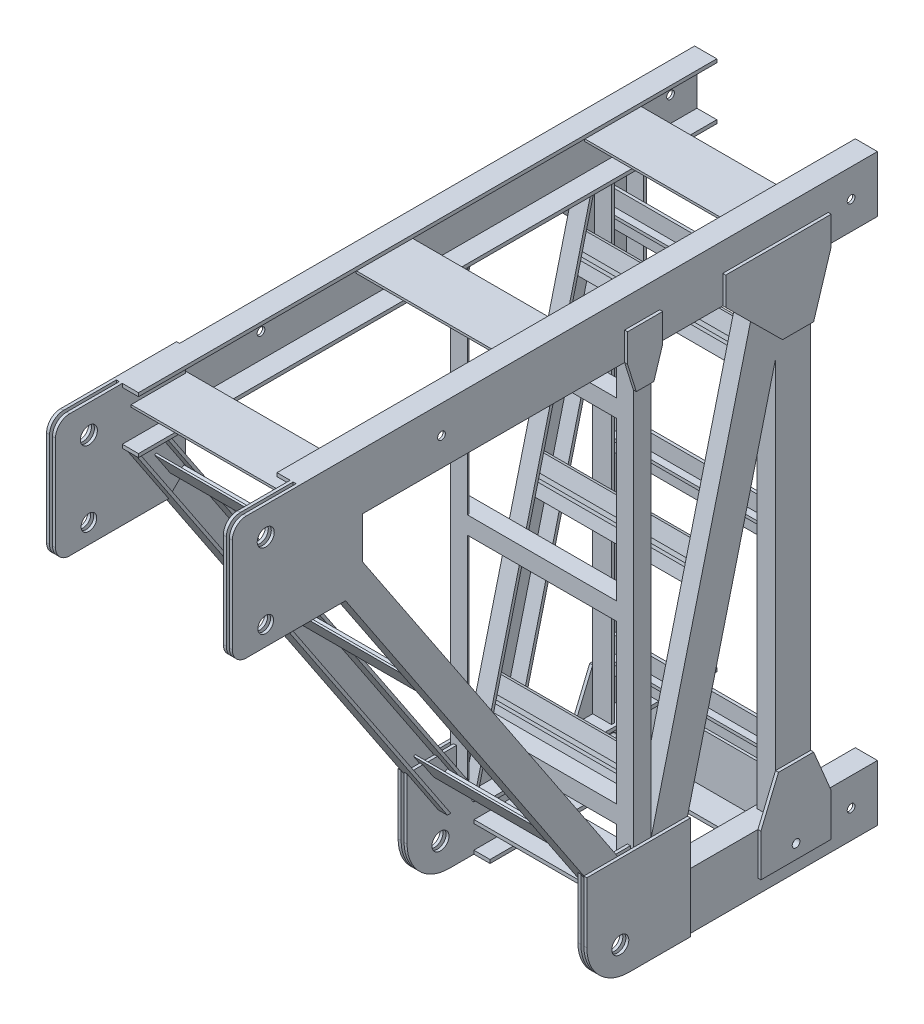
from build123d import *

# Parameters (mm, degrees)
EXTRUDE_1_DEPTH                   = 1835
EXTRUDE_1_2_DEPTH                 = 1835
PATTERN_LINEAR_2_COUNT            = 2
PATTERN_LINEAR_2_PITCH            = 1500
SKETCH_4_W                        = 520
SKETCH_4_H                        = 1000
CUT_EXTRUDE_2_DEPTH               = 1000
EXTRUDE_3_DEPTH                   = 520
SKETCH_8_W                        = 100
SKETCH_8_H                        = 1340
EXTRUDE_7_DEPTH                   = 520
CUT_EXTRUDE_9_DEPTH               = 1340
SKETCH_11_R                       = 11
CUT_EXTRUDE_10_DEPTH              = 2427.442869717
EXTRUDE_11_DEPTH                  = 48
PATTERN_LINEAR_3_COUNT            = 2
PATTERN_LINEAR_3_PITCH            = 472
CUT_EXTRUDE_12_DEPTH              = 42.7
CUT_EXTRUDE_13_DEPTH              = 42.7
EXTRUDE_14_DEPTH                  = 43
PATTERN_LINEAR_4_COUNT            = 2
PATTERN_LINEAR_4_PITCH            = 477
CUT_EXTRUDE_15_DEPTH              = 38
CUT_EXTRUDE_16_DEPTH              = 38
EXTRUDE_17_DEPTH                  = 520
SKETCH_19_W                       = 394
SKETCH_19_H                       = 50
CUT_EXTRUDE_18_DEPTH              = 2427.442869717
CUT_EXTRUDE_19_DEPTH              = 15
CUT_EXTRUDE_20_DEPTH              = 15
CUT_EXTRUDE_21_DEPTH              = 45
CUT_EXTRUDE_22_DEPTH              = 45
PATTERN_LINEAR_6_COUNT            = 3
PATTERN_LINEAR_6_PITCH            = 650
SKETCH_27_W                       = 520
SKETCH_27_H                       = 160
EXTRUDE_24_DEPTH                  = 10
SKETCH_28_W                       = 507
SKETCH_28_H                       = 10
EXTRUDE_25_DEPTH                  = 140
EXTRUDE_26_DEPTH                  = 520
PATTERN_LINEAR_9_COUNT            = 3
PATTERN_LINEAR_9_PITCH            = 550
EXTRUDE_27_DEPTH                  = 520
PATTERN_LINEAR_10_COUNT           = 3
PATTERN_LINEAR_10_PITCH           = 500
EXTRUDE_28_DEPTH                  = 520
SKETCH_32_W                       = 394
SKETCH_32_H                       = 5
EXTRUDE_29_DEPTH                  = 15
PATTERN_LINEAR_11_COUNT           = 3
PATTERN_LINEAR_11_PITCH           = 675
SKETCH_38_W                       = 520
SKETCH_38_H                       = 50
EXTRUDE_36_DEPTH                  = 50
SKETCH_38_2_W                     = 520
SKETCH_38_2_H                     = 50
EXTRUDE_37_DEPTH                  = 50
PATTERN_LINEAR_13_COUNT           = 3
PATTERN_LINEAR_13_PITCH           = 500
SKETCH_39_W                       = 514
SKETCH_39_H                       = 45
CUT_EXTRUDE_38_DEPTH              = 45
SKETCH_40_W                       = 294.761063943
SKETCH_40_H                       = 292.888974491
EXTRUDE_39_DEPTH                  = 8.5
PATTERN_LINEAR_15_COUNT           = 2
PATTERN_LINEAR_15_PITCH           = 17
PATTERN_LINEAR_16_COUNT           = 2
PATTERN_LINEAR_16_PITCH           = 511.5
PATTERN_LINEAR_16_COPY_1_SKETCH_W = 294.761063943
PATTERN_LINEAR_16_COPY_1_SKETCH_H = 292.888974491
PATTERN_LINEAR_16_COPY_1_DEPTH    = 8.5
SKETCH_41_W                       = 8.5
SKETCH_41_H                       = 160
SKETCH_41_W_2                     = 486
CUT_EXTRUDE_40_DEPTH              = 190
SKETCH_42_W                       = 160
SKETCH_42_H                       = 10
EXTRUDE_41_DEPTH                  = 503
FILLET_1_R                        = 120
SKETCH_43_R                       = 24.25
CUT_EXTRUDE_42_DEPTH              = 2431.142794158
SKETCH_44_W                       = 370
SKETCH_44_H                       = 350
EXTRUDE_43_DEPTH                  = 8.5
PATTERN_LINEAR_17_COUNT           = 2
PATTERN_LINEAR_17_PITCH           = 17
SKETCH_45_W                       = 8.5
SKETCH_45_H                       = 350
SKETCH_45_W_2                     = 496.5
CUT_EXTRUDE_44_DEPTH              = 190
CHAMFER_1_SIZE                    = 50
SKETCH_46_R                       = 24.25
CUT_EXTRUDE_45_DEPTH              = 2431.142794158
EXTRUDE_46_DEPTH                  = 8.5
PATTERN_LINEAR_19_COUNT           = 2
PATTERN_LINEAR_19_PITCH           = 528.5
PATTERN_LINEAR_20_COUNT           = 2
PATTERN_LINEAR_20_PITCH           = 520
PATTERN_LINEAR_21_COUNT           = 2
PATTERN_LINEAR_21_PITCH           = 503
SKETCH_49_R                       = 24.25
SKETCH_49_R_2                     = 22.25
CUT_EXTRUDE_48_DEPTH              = 2429.278659874
FILLET_2_R                        = 40
SKETCH_50_R                       = 11
CUT_EXTRUDE_49_DEPTH              = 2431.142794158


with BuildPart() as part:
    # 草图2 → 拉伸1 (new body)
    with BuildSketch(Plane.XY):
        Polygon((0, 0), (0, 160), (63, 160), (63, 150), (6.5, 150), (6.5, 10), (63, 10), (63, 0), align=None)
    extrude_1 = extrude(amount=EXTRUDE_1_DEPTH)



with BuildPart() as body_2:
    # 草图2 → Extrude 1 2 (new body)
    with BuildSketch(Plane.XY):
        Polygon((457, 160), (520, 160), (520, 0), (457, 0), (457, 10), (513.5, 10), (513.5, 150), (457, 150), align=None)
    extrude_1_2 = extrude(amount=EXTRUDE_1_2_DEPTH)


with BuildPart() as pattern_linear_2_1:
    # 阵列(线性)2: pattern copy
    add(extrude_1.moved(Location(Vector(0, -1, 0) * (1 * PATTERN_LINEAR_2_PITCH))))


with BuildPart() as pattern_linear_2_2:
    # 阵列(线性)2: pattern copy
    add(extrude_1_2.moved(Location(Vector(0, -1, 0) * (1 * PATTERN_LINEAR_2_PITCH))))


with BuildPart() as cut_extrude_2_tool:
    # 草图4 → 拉伸2 (new body)
    with BuildSketch(Plane(origin=(0, -1340, 0), x_dir=(1, 0, 0), z_dir=(0, 1, 0))):
        with Locations((260, -1335)):
            Rectangle(SKETCH_4_W, SKETCH_4_H)
    extrude(amount=-CUT_EXTRUDE_2_DEPTH)


with BuildPart() as pattern_linear_2_1_1:
    add(pattern_linear_2_1.part)

    # 拉伸2: cut by cut_extrude_2_tool
    add(cut_extrude_2_tool.part, mode=Mode.SUBTRACT)


with BuildPart() as pattern_linear_2_2_1:
    add(pattern_linear_2_2.part)

    # 拉伸2: cut by cut_extrude_2_tool
    add(cut_extrude_2_tool.part, mode=Mode.SUBTRACT)


with BuildPart() as part_1:
    add(part.part)

    add(body_2.part)  # 拉伸3 merges body 2
    # 草图5 → 拉伸3 (add)
    with BuildSketch(Plane.ZY):
        Polygon((160, 95), (320, 95), (320, 88.5), (243.25, 88.5), (243.25, 48.5), (236.75, 48.5), (236.75, 88.5), (160, 88.5), align=None)
    extrude_3 = extrude(amount=-EXTRUDE_3_DEPTH)

    # 草图11 → 拉伸10 (cut, through all)
    with BuildSketch(Plane.ZY):
        with Locations((1740, 80)):
            Circle(SKETCH_11_R)
    extrude(amount=-CUT_EXTRUDE_10_DEPTH, mode=Mode.SUBTRACT)


    add(pattern_linear_2_1_1.part)  # 拉伸11 merges 阵列(线性)2_1


with BuildPart() as body_4:
    # 草图8 → 拉伸7 (new body)
    with BuildSketch(Plane.ZY):
        with Locations((240, -670)):
            Rectangle(SKETCH_8_W, SKETCH_8_H)
    extrude(amount=-EXTRUDE_7_DEPTH)

    # 草图10 → 拉伸9 (cut)
    with BuildSketch(Plane.XZ.offset(1340)):
        Polygon((466.7, 290), (466.7, 281.5), (514.7, 281.5), (514.7, 198.5), (466.7, 198.5), (466.7, 190), (53.3, 190), (53.3, 198.5), (5.3, 198.5), (5.3, 281.5), (53.3, 281.5), (53.3, 290), align=None)
    extrude(amount=-CUT_EXTRUDE_9_DEPTH, mode=Mode.SUBTRACT)


with BuildPart() as cut_extrude_9_piece_1:
    # of the separate pieces the step leaves, piece 1, a body of its own (cut_extrude_9_pieces)
    add(body_4.part.solids().sort_by_distance((0, 0, 190))[0])


with BuildPart() as cut_extrude_9_piece_2:
    # of the separate pieces the step leaves, piece 2, a body of its own (cut_extrude_9_pieces)
    add(body_4.part.solids().sort_by_distance((466.7, 0, 198.5))[0])


with BuildPart() as part_2:
    add(part_1.part)

    add(cut_extrude_9_piece_1.part)  # 拉伸11 merges 拉伸9 piece 1
    # 草图12 → 拉伸11 (add)
    with BuildSketch(Plane.ZY):
        Polygon((290, 0), (341.53882032, 0), (676.53882032, -1340), (573.46117968, -1340), (290, -206.155281281), align=None)
    extrude_11 = extrude(amount=-EXTRUDE_11_DEPTH)


    add(pattern_linear_2_2_1.part)  # 阵列(线性)3 merges 阵列(线性)2_2

    add(cut_extrude_9_piece_2.part)  # 阵列(线性)3 merges 拉伸9 piece 2
    # 阵列(线性)3: 拉伸11 ×2
    with Locations(*[(i * PATTERN_LINEAR_3_PITCH, 0, 0) for i in range(1, PATTERN_LINEAR_3_COUNT)]):
        add(extrude_11)

    # 草图13 → 拉伸12 (cut)
    with BuildSketch(Plane(origin=(48, 0, 0), x_dir=(0, 0, -1), z_dir=(1, 0, 0))):
        Polygon((-332.777220866, 0), (-290, 0), (-290, -171.108883463), (-582.222779134, -1340), (-667.777220866, -1340), align=None)
    extrude(amount=-CUT_EXTRUDE_12_DEPTH, mode=Mode.SUBTRACT)

    # 草图14 → 拉伸13 (cut)
    with BuildSketch(Plane.ZY.offset(-472)):
        Polygon((290, -241.201679099), (290, 0), (332.777220866, 0), (667.777220866, -1340), (564.699580225, -1340), align=None)
    extrude(amount=-CUT_EXTRUDE_13_DEPTH, mode=Mode.SUBTRACT)

    # 草图15 → 拉伸14 (add)
    with BuildSketch(Plane.ZY):
        Polygon((1591.666666667, 0), (1543.59264966, 0), (669.371682868, -1311.331450189), (676.53882032, -1340), (746.40735034, -1340), (1639.740683673, 0), align=None)
    extrude_14 = extrude(amount=-EXTRUDE_14_DEPTH)

    # 阵列(线性)4: 拉伸14 ×2
    with Locations(*[(i * PATTERN_LINEAR_4_PITCH, 0, 0) for i in range(1, PATTERN_LINEAR_4_COUNT)]):
        add(extrude_14)

    # 草图16 → 拉伸15 (cut)
    with BuildSketch(Plane.ZY.offset(-477)):
        Polygon((1553.207453062, 0), (1630.125880272, 0), (736.792546938, -1340), (659.874119728, -1340), align=None)
    extrude(amount=-CUT_EXTRUDE_15_DEPTH, mode=Mode.SUBTRACT)

    # 草图17 → 拉伸16 (cut)
    with BuildSketch(Plane(origin=(43, 0, 0), x_dir=(0, 0, -1), z_dir=(1, 0, 0))):
        Polygon((-1630.125880272, 0), (-1553.207453062, 0), (-659.874119728, -1340), (-736.792546938, -1340), align=None)
    extrude(amount=-CUT_EXTRUDE_16_DEPTH, mode=Mode.SUBTRACT)

    # 阵列(线性)6: 拉伸3 ×3
    with Locations(*[(0, 0, i * PATTERN_LINEAR_6_PITCH) for i in range(1, PATTERN_LINEAR_6_COUNT)]):
        add(extrude_3)

    # 草图27 → 拉伸24 (add)
    with BuildSketch(Plane.XZ.offset(1500)):
        with Locations((260, 160)):
            Rectangle(SKETCH_27_W, SKETCH_27_H)
    extrude(amount=-EXTRUDE_24_DEPTH)

    # 草图28 → 拉伸25 (add)
    with BuildSketch(Plane(origin=(0, -1490, 0), x_dir=(1, 0, 0), z_dir=(0, 1, 0))):
        with Locations((260, -157.5)):
            Rectangle(SKETCH_28_W, SKETCH_28_H)
    extrude(amount=EXTRUDE_25_DEPTH)

    # 草图29 → 拉伸26 (add)
    with BuildSketch(Plane.ZY):
        Polygon((231.5, -1165), (231.5, -1265), (240, -1265), (240, -1219.25), (260, -1219.25), (260, -1210.75), (240, -1210.75), (240, -1165), align=None)
    extrude_26 = extrude(amount=-EXTRUDE_26_DEPTH)

    # 阵列(线性)9: 拉伸26 ×3
    with Locations(*[(0, i * PATTERN_LINEAR_9_PITCH, 0) for i in range(1, PATTERN_LINEAR_9_COUNT)]):
        add(extrude_26)

    # 草图30 → 拉伸27 (add)
    with BuildSketch(Plane.ZY):
        Polygon((313.889759066, -130.605434082), (338.14332157, -227.619684097), (346.389532821, -225.558131284), (335.293527976, -181.174111902), (354.696377978, -176.323399401), (352.634825166, -168.07718815), (333.231975163, -172.927900651), (322.135970317, -128.543881269), align=None)
    extrude_27 = extrude(amount=-EXTRUDE_27_DEPTH)

    # 阵列(线性)10: 拉伸27 ×3
    with Locations(*[Vector(0, -0.9701425001453319, 0.24253562503633289) * (i * PATTERN_LINEAR_10_PITCH) for i in range(1, PATTERN_LINEAR_10_COUNT)]):
        add(extrude_27)

    # 草图31 → 拉伸28 (add)
    with BuildSketch(Plane(origin=(520, 0, 0), x_dir=(0, 0, -1), z_dir=(1, 0, 0))):
        Polygon((-1548.908526541, -59.630271094), (-1504.532510843, -126.194294641), (-1508.692762315, -128.967795622), (-1553.068778013, -62.403772075), align=None)
    extrude_28 = extrude(amount=-EXTRUDE_28_DEPTH)

    # 草图32 → 拉伸29 (add)
    with BuildSketch(Plane(origin=(0, -733.228634125, 1099.842951187), x_dir=(-1, 0, 0), z_dir=(0, 0.5547001962252273, -0.8320502943378449))):
        with Locations((-260, 769.564478992)):
            Rectangle(SKETCH_32_W, SKETCH_32_H)
    extrude_29 = extrude(amount=EXTRUDE_29_DEPTH)

    # 阵列(线性)11: 拉伸28, 拉伸29 ×3
    with Locations(*[Vector(0, -0.8320502943378444, -0.5547001962252281) * (i * PATTERN_LINEAR_11_PITCH) for i in range(1, PATTERN_LINEAR_11_COUNT)]):
        add(extrude_28)
        add(extrude_29)


with BuildPart() as body_2_2:
    # 草图18 → 拉伸17 (new body)
    with BuildSketch(Plane.ZY):
        Polygon((644.371682868, 0), (694.371682868, 0), (694.371682868, -1273.831450189), (669.371682868, -1311.331450189), (644.371682868, -1211.331450189), align=None)
    extrude(amount=-EXTRUDE_17_DEPTH)

    # 草图19 → 拉伸18 (cut, through all)
    with BuildSketch(Plane(origin=(0, 0, 0), x_dir=(1, 0, 0), z_dir=(0, 1, 0))):
        with Locations((260, -669.371682868)):
            Rectangle(SKETCH_19_W, SKETCH_19_H)
    extrude(amount=-CUT_EXTRUDE_18_DEPTH, mode=Mode.SUBTRACT)


with BuildPart() as cut_extrude_18_piece_1:
    # of the separate pieces the step leaves, piece 1, a body of its own (cut_extrude_18_pieces)
    add(body_2_2.part.solids().sort_by_distance((0, 0, 644.371682868))[0])

    # 草图21 → 拉伸20 (cut)
    with BuildSketch(Plane(origin=(63, 0, 0), x_dir=(0, 0, -1), z_dir=(1, 0, 0))):
        Polygon((-694.371682868, -1273.831450189), (-669.371682868, -1311.331450189), (-644.371682868, -1211.331450189), (-644.371682868, 0), (-694.371682868, 0), align=None)
    extrude(amount=-CUT_EXTRUDE_20_DEPTH, mode=Mode.SUBTRACT)

    # 草图24 → 拉伸22 (cut)
    with BuildSketch(Plane(origin=(48, 0, 0), x_dir=(0, 0, -1), z_dir=(1, 0, 0))):
        Polygon((-689.371682868, -1281.331450189), (-669.371682868, -1311.331450189), (-644.371682868, -1211.331450189), (-644.371682868, 0), (-689.371682868, 0), align=None)
    extrude(amount=-CUT_EXTRUDE_22_DEPTH, mode=Mode.SUBTRACT)


with BuildPart() as cut_extrude_18_piece_2:
    # of the separate pieces the step leaves, piece 2, a body of its own (cut_extrude_18_pieces)
    add(body_2_2.part.solids().sort_by_distance((457, 0, 694.371682868))[0])

    # 草图20 → 拉伸19 (cut)
    with BuildSketch(Plane.ZY.offset(-457)):
        Polygon((644.371682868, 0), (694.371682868, 0), (694.371682868, -1273.831450189), (669.371682868, -1311.331450189), (644.371682868, -1211.331450189), align=None)
    extrude(amount=-CUT_EXTRUDE_19_DEPTH, mode=Mode.SUBTRACT)

    # 草图23 → 拉伸21 (cut)
    with BuildSketch(Plane.ZY.offset(-472)):
        Polygon((689.371682868, -1281.331450189), (669.371682868, -1311.331450189), (644.371682868, -1211.331450189), (644.371682868, 0), (689.371682868, 0), align=None)
    extrude(amount=-CUT_EXTRUDE_21_DEPTH, mode=Mode.SUBTRACT)


    add(cut_extrude_18_piece_1.part)  # 拉伸36 merges 拉伸18 piece 1

    add(part_2.part)  # 拉伸36 merges part
    # 草图38 → 拉伸36 (add)
    with BuildSketch(Plane.XY.offset(694.371682868)):
        with Locations((260, -1148.831450189)):
            Rectangle(SKETCH_38_W, SKETCH_38_H)
    extrude(amount=-EXTRUDE_36_DEPTH)

    # 草图38<2> → 拉伸37 (add)
    with BuildSketch(Plane.XY.offset(694.371682868)):
        with Locations((260, -1148.831450189)):
            Rectangle(SKETCH_38_2_W, SKETCH_38_2_H)
    extrude_37 = extrude(amount=-EXTRUDE_37_DEPTH)

    # 阵列(线性)13: 拉伸37 ×3
    with Locations(*[(0, i * PATTERN_LINEAR_13_PITCH, 0) for i in range(1, PATTERN_LINEAR_13_COUNT)]):
        add(extrude_37)

    # 草图39 → 拉伸38 (cut)
    with BuildSketch(Plane(origin=(0, 0, 644.371682868), x_dir=(-1, 0, 0), z_dir=(0, 0, -1))):
        with Locations((-260, -1151.331450189)):
            Rectangle(SKETCH_39_W, SKETCH_39_H)
        with Locations((-260, -651.331450189)):
            Rectangle(SKETCH_39_W, SKETCH_39_H)
        with Locations((-260, -151.331450189)):
            Rectangle(SKETCH_39_W, SKETCH_39_H)
    extrude(amount=-CUT_EXTRUDE_38_DEPTH, mode=Mode.SUBTRACT)

    # 草图40 → 拉伸39 (add)
    with BuildSketch(Plane(origin=(520, 0, 0), x_dir=(0, 0, -1), z_dir=(1, 0, 0))):
        with Locations((-687.619468029, -1353.555512754)):
            Rectangle(SKETCH_40_W, SKETCH_40_H)
    extrude_39 = extrude(amount=EXTRUDE_39_DEPTH)

    # 阵列(线性)15: 拉伸39 ×2
    with Locations(*[(-i * PATTERN_LINEAR_15_PITCH, 0, 0) for i in range(1, PATTERN_LINEAR_15_COUNT)]):
        add(extrude_39)

    # 阵列(线性)16: 拉伸39 ×2
    with Locations(*[(-i * PATTERN_LINEAR_16_PITCH, 0, 0) for i in range(1, PATTERN_LINEAR_16_COUNT)]):
        add(extrude_39)

    # 阵列(线性)16 copy 1 sketch → 阵列(线性)16 copy 1 (add)
    with BuildSketch(Plane(origin=(-8.5, 0, 0), x_dir=(0, 0, -1), z_dir=(1, 0, 0))):
        with Locations((-687.619468029, -1353.555512754)):
            Rectangle(PATTERN_LINEAR_16_COPY_1_SKETCH_W, PATTERN_LINEAR_16_COPY_1_SKETCH_H)
    extrude(amount=PATTERN_LINEAR_16_COPY_1_DEPTH)

    # 草图41 → 拉伸40 (cut)
    with BuildSketch(Plane.XY.offset(835)):
        with Locations((4.25, -1420)):
            Rectangle(SKETCH_41_W, SKETCH_41_H)
        with Locations((260, -1420)):
            Rectangle(SKETCH_41_W_2, SKETCH_41_H)
        with Locations((515.75, -1420)):
            Rectangle(SKETCH_41_W, SKETCH_41_H)
    extrude(amount=-CUT_EXTRUDE_40_DEPTH, mode=Mode.SUBTRACT)

    # 草图42 → 拉伸41 (add)
    with BuildSketch(Plane.ZY.offset(-503)):
        with Locations((564.371682868, -1420)):
            Rectangle(SKETCH_42_W, SKETCH_42_H)
    extrude(amount=EXTRUDE_41_DEPTH)

    # 圆角1
    fillet_1_edges = [cut_extrude_18_piece_2.edges().sort_by_distance(p)[0] for p in [
        (524.25, -1500, 835),
        (-4.25, -1500, 835),
        (12.75, -1500, 835),
        (507.25, -1500, 835),
    ]]
    fillet(fillet_1_edges, radius=FILLET_1_R)

    # 草图43 → 拉伸42 (cut, through all)
    with BuildSketch(Plane.ZY.offset(8.5)):
        with Locations((740, -1420)):
            Circle(SKETCH_43_R)
    extrude(amount=-CUT_EXTRUDE_42_DEPTH, mode=Mode.SUBTRACT)

    # 草图44 → 拉伸43 (add)
    with BuildSketch(Plane.ZY):
        with Locations((1650, -15)):
            Rectangle(SKETCH_44_W, SKETCH_44_H)
    extrude_43 = extrude(amount=EXTRUDE_43_DEPTH)

    # 阵列(线性)17: 拉伸43 ×2
    with Locations(*[(i * PATTERN_LINEAR_17_PITCH, 0, 0) for i in range(1, PATTERN_LINEAR_17_COUNT)]):
        add(extrude_43)

    # 草图45 → 拉伸44 (cut)
    with BuildSketch(Plane.XY.offset(1835)):
        with Locations((4.25, -15)):
            Rectangle(SKETCH_45_W, SKETCH_45_H)
        with Locations((265.25, -15)):
            Rectangle(SKETCH_45_W_2, SKETCH_45_H)
    extrude(amount=-CUT_EXTRUDE_44_DEPTH, mode=Mode.SUBTRACT)

    # 倒角1
    # the kernel refuses this chamfer: 50 mm, written as the material it takes off along each edge
    with BuildSketch(Plane(origin=(128.584149398, -190, 1465), x_dir=(0, 0.9996219169112966, -0.027495876610586615), z_dir=(-1, 0, 0))) as chamfer_1_piece_1_section:
        Polygon((CHAMFER_1_SIZE * 0.999621916911, -CHAMFER_1_SIZE * 0.0274958766106), (-CHAMFER_1_SIZE * 0.0274958766106, -CHAMFER_1_SIZE * 0.999621916911), (0, 0), align=None)
    chamfer_1_piece_1 = extrude(amount=265.668298797, mode=Mode.PRIVATE)
    chamfer_1_piece_1 = split(chamfer_1_piece_1, bisect_by=Plane(origin=(5, -172.859199894, 1480.769211679), z_dir=(1, 0, 0)), keep=Keep.TOP, mode=Mode.PRIVATE)
    chamfer_1_piece_1 = split(chamfer_1_piece_1, bisect_by=Plane(origin=(12.75, -188.605600815, 1504.388813062), z_dir=(0, 0.5547001962252293, -0.8320502943378437)), keep=Keep.TOP, mode=Mode.PRIVATE)
    add(chamfer_1_piece_1, mode=Mode.SUBTRACT)
    with BuildSketch(Plane(origin=(0, -190, 1465), x_dir=(0, 0.9996219169112966, -0.027495876610586587), z_dir=(-1, 0, 0))) as chamfer_1_piece_2:
        Polygon((CHAMFER_1_SIZE * 0.999621916911, -CHAMFER_1_SIZE * 0.0274958766106), (-CHAMFER_1_SIZE * 0.0274958766106, -CHAMFER_1_SIZE * 0.999621916911), (0, 0), align=None)
    extrude(amount=137.084149398, mode=Mode.SUBTRACT)
    with BuildSketch(Plane(origin=(145.584149398, -190, 1465), x_dir=(0, 0.9996219169112966, -0.027495876610586615), z_dir=(-1, 0, 0))) as chamfer_1_piece_3_section:
        Polygon((CHAMFER_1_SIZE * 0.999621916911, -CHAMFER_1_SIZE * 0.0274958766106), (-CHAMFER_1_SIZE * 0.0274958766106, -CHAMFER_1_SIZE * 0.999621916911), (0, 0), align=None)
    chamfer_1_piece_3 = extrude(amount=265.668298797, mode=Mode.PRIVATE)
    chamfer_1_piece_3 = split(chamfer_1_piece_3, bisect_by=Plane(origin=(5, -172.859199894, 1480.769211679), z_dir=(1, 0, 0)), keep=Keep.TOP, mode=Mode.PRIVATE)
    chamfer_1_piece_3 = split(chamfer_1_piece_3, bisect_by=Plane(origin=(12.75, -188.605600815, 1504.388813062), z_dir=(0, 0.5547001962252293, -0.8320502943378437)), keep=Keep.TOP, mode=Mode.PRIVATE)
    add(chamfer_1_piece_3, mode=Mode.SUBTRACT)
    with BuildSketch(Plane(origin=(145.584149398, -190, 1465), x_dir=(0, 0.9996219169112966, -0.027495876610586615), z_dir=(-1, 0, 0))) as chamfer_1_piece_4_section:
        Polygon((CHAMFER_1_SIZE * 0.999621916911, -CHAMFER_1_SIZE * 0.0274958766106), (-CHAMFER_1_SIZE * 0.0274958766106, -CHAMFER_1_SIZE * 0.999621916911), (0, 0), align=None)
    chamfer_1_piece_4 = extrude(amount=265.668298797, mode=Mode.PRIVATE)
    chamfer_1_piece_4 = split(chamfer_1_piece_4, bisect_by=Plane(origin=(0, -172.859199894, 1480.769211679), z_dir=(-1, 0, 0)), keep=Keep.TOP, mode=Mode.PRIVATE)
    add(chamfer_1_piece_4, mode=Mode.SUBTRACT)

    # 草图46 → 拉伸45 (cut, through all)
    with BuildSketch(Plane.ZY.offset(8.5)):
        with Locations(Location((1740, 80, 0), (0, 0, 90))):
            Circle(SKETCH_46_R)
    extrude(amount=-CUT_EXTRUDE_45_DEPTH, mode=Mode.SUBTRACT)

    # 草图47 → 拉伸46 (add)
    with BuildSketch(Plane.ZY):
        Polygon((140, 80), (140, 0), (190, -160), (278.46117968, -160), (440, 0), (440, 80), align=None)
        Polygon((140, -1460), (340, -1460), (340, -1340), (290, -1220), (190, -1220), (140, -1340), align=None)
        Polygon((619.371682868, 80), (719.371682868, 80), (719.371682868, 0), (694.371682868, -80), (644.371682868, -80), (619.371682868, 0), align=None)
    extrude_46 = extrude(amount=EXTRUDE_46_DEPTH)

    # 阵列(线性)19: 拉伸46 ×2
    with Locations(*[(i * PATTERN_LINEAR_19_PITCH, 0, 0) for i in range(1, PATTERN_LINEAR_19_COUNT)]):
        add(extrude_46)

    # 阵列(线性)20: 拉伸43 ×2
    with Locations(*[(i * PATTERN_LINEAR_20_PITCH, 0, 0) for i in range(1, PATTERN_LINEAR_20_COUNT)]):
        add(extrude_43)

    # 阵列(线性)21: 拉伸43 ×2
    with Locations(*[(i * PATTERN_LINEAR_21_PITCH, 0, 0) for i in range(1, PATTERN_LINEAR_21_COUNT)]):
        add(extrude_43)

    # 草图49 → 拉伸48 (cut, through all)
    with BuildSketch(Plane(origin=(520, 0, 0), x_dir=(0, 0, -1), z_dir=(1, 0, 0))):
        with Locations(Location((-1740, 80, 0), (0, 0, 90))):
            Circle(SKETCH_49_R)
        with Locations(Location((-1740, -135, 0), (0, 0, 90))):
            Circle(SKETCH_49_R_2)
    extrude(amount=-CUT_EXTRUDE_48_DEPTH, mode=Mode.SUBTRACT)

    # 圆角2
    fillet_2_edges = [cut_extrude_18_piece_2.edges().sort_by_distance(p)[0] for p in [
        (-4.25, -190, 1835),
        (12.75, -190, 1835),
        (-4.25, 160, 1835),
        (12.75, 160, 1835),
        (515.75, 160, 1835),
        (515.75, -190, 1835),
        (498.75, 160, 1835),
        (498.75, -190, 1835),
    ]]
    fillet(fillet_2_edges, radius=FILLET_2_R)

    # 草图50 → 拉伸49 (cut, through all)
    with BuildSketch(Plane.ZY.offset(8.5)):
        with Locations(Location((1240, 80, 0), (0, 0, 270))):
            Circle(SKETCH_50_R)
        with Locations(Location((240, -1420, 0), (0, 0, 270))):
            Circle(SKETCH_50_R)
        with Locations(Location((75, 80, 0), (0, 0, 270))):
            Circle(SKETCH_50_R)
        with Locations(Location((75, -1420, 0), (0, 0, 270))):
            Circle(SKETCH_50_R)
    extrude(amount=-CUT_EXTRUDE_49_DEPTH, mode=Mode.SUBTRACT)


solid = cut_extrude_18_piece_2.part
